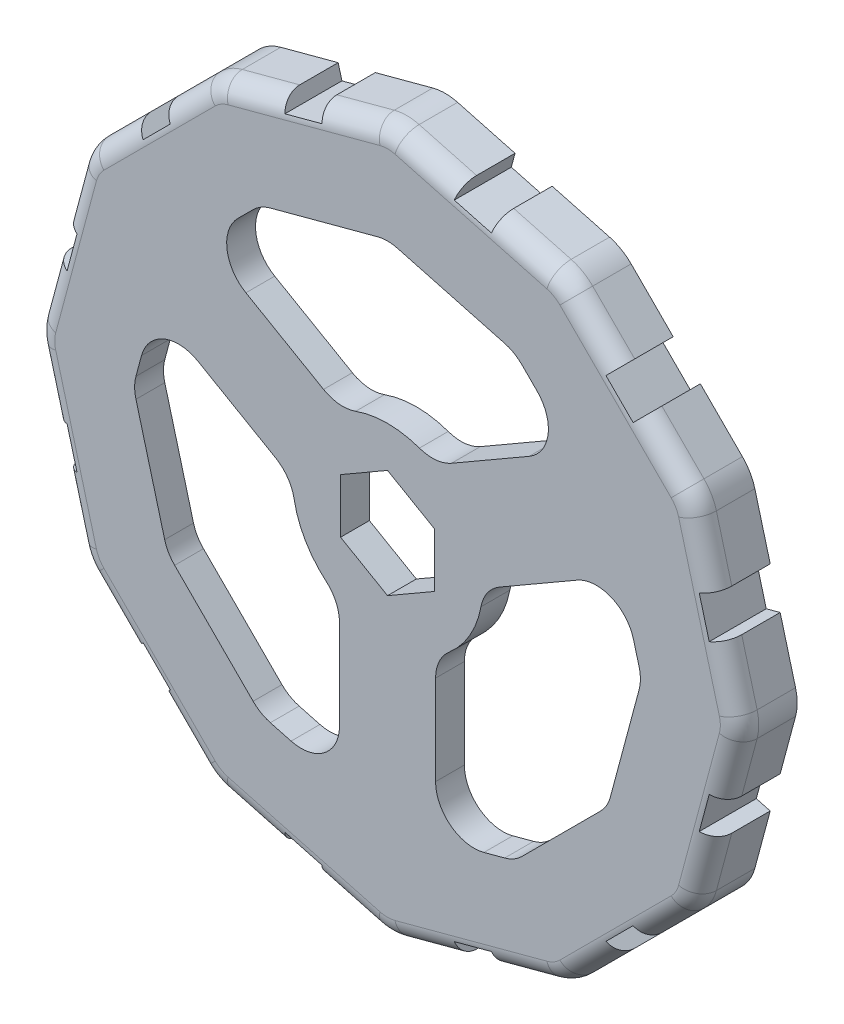
from build123d import *

# Parameters (mm, degrees)
BOSS_EXTRUDE1_DEPTH = 3
BOSS_EXTRUDE2_DEPTH = 3
CUT_EXTRUDE1_DEPTH  = 53.408045027
FILLET1_R           = 5
CUT_EXTRUDE2_DEPTH  = 3
FILLET3_R           = 4
FILLET4_R           = 2
CIRPATTERN1_COUNT   = 12
FILLET5_R           = 3


with BuildPart() as part:
    # Sketch1 → Boss-Extrude1 (new body)
    # profile 1 of 2: a face of its own
    with BuildSketch(Plane.XY):
        Polygon((31.88222379, 18.407210488), (18.407210488, 31.88222379), (0, 36.814420975), (-18.407210488, 31.88222379), (-31.88222379, 18.407210488), (-36.814420975, 0), (-31.88222379, -18.407210488), (-18.407210488, -31.88222379), (0, -36.814420975), (18.407210488, -31.88222379), (31.88222379, -18.407210488), (36.814420975, 0), align=None)
        Polygon((-15.819020037, -27.399346429), (0, -31.638040073), (15.819020037, -27.399346429), (27.399346429, -15.819020037), (31.638040073, 0), (27.399346429, 15.819020037), (15.819020037, 27.399346429), (0, 31.638040073), (-15.819020037, 27.399346429), (-27.399346429, 15.819020037), (-31.638040073, 0), (-27.399346429, -15.819020037), align=None, mode=Mode.SUBTRACT)
    # profile 2 of 2: a face of its own
    with BuildSketch(Plane.XY):
        Polygon((-27.399346429, -15.819020037), (-15.819020037, -27.399346429), (0, -31.638040073), (15.819020037, -27.399346429), (27.399346429, -15.819020037), (31.638040073, 0), (27.399346429, 15.819020037), (15.819020037, 27.399346429), (0, 31.638040073), (-15.819020037, 27.399346429), (-27.399346429, 15.819020037), (-31.638040073, 0), align=None)
        Polygon((4.8875, 2.821799441), (0, 5.643598881), (-4.8875, 2.821799441), (-4.8875, -2.821799441), (0, -5.643598881), (4.8875, -2.821799441), align=None, mode=Mode.SUBTRACT)
    extrude(amount=BOSS_EXTRUDE1_DEPTH)

    # Sketch1<3> → Boss-Extrude2 (add)
    with BuildSketch(Plane.XY):
        Polygon((31.88222379, 18.407210488), (18.407210488, 31.88222379), (0, 36.814420975), (-18.407210488, 31.88222379), (-31.88222379, 18.407210488), (-36.814420975, 0), (-31.88222379, -18.407210488), (-18.407210488, -31.88222379), (0, -36.814420975), (18.407210488, -31.88222379), (31.88222379, -18.407210488), (36.814420975, 0), align=None)
        Polygon((-15.819020037, -27.399346429), (0, -31.638040073), (15.819020037, -27.399346429), (27.399346429, -15.819020037), (31.638040073, 0), (27.399346429, 15.819020037), (15.819020037, 27.399346429), (0, 31.638040073), (-15.819020037, 27.399346429), (-27.399346429, 15.819020037), (-31.638040073, 0), (-27.399346429, -15.819020037), align=None, mode=Mode.SUBTRACT)
    extrude(amount=-BOSS_EXTRUDE2_DEPTH)

    # Sketch2 → Cut-Extrude1 (cut, through all)
    with BuildSketch(Plane.XY.offset(3)):
        Polygon((7.271753591, 34.865960473), (11.135456896, 33.830684293), (10.747228329, 32.381795553), (6.883525024, 33.417071734), align=None)
    cut_extrude1 = extrude(amount=-CUT_EXTRUDE1_DEPTH, mode=Mode.SUBTRACT)

    # Fillet1
    fillet1_edges = [part.edges().sort_by_distance(p)[0] for p in [
        (31.88222379, 18.407210488, 0),
        (36.814420975, 0, 0),
        (31.88222379, -18.407210488, 0),
        (18.407210488, -31.88222379, 0),
        (0, -36.814420975, 0),
        (-18.407210488, -31.88222379, 0),
        (-31.88222379, -18.407210488, 0),
        (-36.814420975, 0, 0),
        (-31.88222379, 18.407210488, 0),
        (-18.407210488, 31.88222379, 0),
        (0, 36.814420975, 0),
        (18.407210488, 31.88222379, 0),
    ]]
    fillet(fillet1_edges, radius=FILLET1_R)

    # Sketch4 → Cut-Extrude2 (cut)
    with BuildSketch(Plane(origin=(0, 0, 0), x_dir=(-1, 0, 0), z_dir=(0, 0, -1))):
        with BuildLine():
            Line((13.230829586, 22.916469069), (0, 26.461659171))
            Line((0, 26.461659171), (-13.230829586, 22.916469069))
            Line((-13.230829586, 22.916469069), (-19.256215031, 16.891083623))
            Line((-19.256215031, 16.891083623), (-4.8875, 8.595302133))
            ThreePointArc((-4.8875, 8.595302133), (0, 9.887713335), (4.8875, 8.595302133))
            Line((4.8875, 8.595302133), (19.256215031, 16.891083623))
            Line((19.256215031, 16.891083623), (13.230829586, 22.916469069))
        make_face()
        with BuildLine():
            Line((5, -8.530350227), (5, -25.121913209))
            Line((5, -25.121913209), (13.230829586, -22.916469069))
            Line((13.230829586, -22.916469069), (22.916469069, -13.230829586))
            Line((22.916469069, -13.230829586), (26.461659171, 0))
            Line((26.461659171, 0), (24.256215031, 8.230829586))
            Line((24.256215031, 8.230829586), (9.8875, -0.064951905))
            ThreePointArc((9.8875, -0.064951905), (8.563010934, -4.943856668), (5, -8.530350227))
        make_face()
        with BuildLine():
            Line((-9.8875, -0.064951905), (-24.256215031, 8.230829586))
            Line((-24.256215031, 8.230829586), (-26.461659171, 0))
            Line((-26.461659171, 0), (-22.916469069, -13.230829586))
            Line((-22.916469069, -13.230829586), (-13.230829586, -22.916469069))
            Line((-13.230829586, -22.916469069), (-5, -25.121913209))
            Line((-5, -25.121913209), (-5, -8.530350227))
            ThreePointArc((-5, -8.530350227), (-8.563010934, -4.943856668), (-9.8875, -0.064951905))
        make_face()
    extrude(amount=-CUT_EXTRUDE2_DEPTH, mode=Mode.SUBTRACT)

    # Fillet3
    fillet3_edges = [part.edges().sort_by_distance(p)[0] for p in [
        (-5, -8.530350227, 1.5),
        (-9.8875, -0.064951905, 1.5),
        (-24.256215031, 8.230829586, 1.5),
        (-26.461659171, 0, 1.5),
        (-22.916469069, -13.230829586, 1.5),
        (-13.230829586, -22.916469069, 1.5),
        (-5, -25.121913209, 1.5),
        (-4.8875, 8.595302133, 1.5),
        (4.8875, 8.595302133, 1.5),
        (19.256215031, 16.891083623, 1.5),
        (13.230829586, 22.916469069, 1.5),
        (0, 26.461659171, 1.5),
        (-13.230829586, 22.916469069, 1.5),
        (-19.256215031, 16.891083623, 1.5),
        (9.8875, -0.064951905, 1.5),
        (5, -8.530350227, 1.5),
        (5, -25.121913209, 1.5),
        (13.230829586, -22.916469069, 1.5),
        (22.916469069, -13.230829586, 1.5),
        (26.461659171, 0, 1.5),
        (24.256215031, 8.230829586, 1.5),
    ]]
    fillet(fillet3_edges, radius=FILLET3_R)

    # Fillet4
    # the kernel refuses this fillet: 2 mm, written as the material it takes off along each edge
    with BuildSketch(Plane(origin=(1.294095226, -36.467669205, 3), x_dir=(-0.25881904510251225, 0.9659258262890706, 0), z_dir=(0.9659258262890706, 0.25881904510251225, 0)), Plane(origin=(-17.113115262, -32.228975561, 3), x_dir=(0.2588190451025292, 0.9659258262890661, 0), z_dir=(0.9659258262890661, -0.2588190451025292, 0)), Plane(origin=(-1.294095226, 36.467669205, 3), x_dir=(0.25881904510251297, -0.9659258262890704, 0), z_dir=(-0.9659258262890704, -0.25881904510251297, 0)), Plane(origin=(-19.354553943, 30.934880335, 3), x_dir=(0.7071067811865416, -0.7071067811865536, 0), z_dir=(-0.7071067811865536, -0.7071067811865415, 0)), Plane(origin=(-32.228975561, 17.113115262, 3), x_dir=(0.9659258262890664, -0.25881904510252784, 0), z_dir=(-0.2588190451025279, -0.9659258262890664, 0)), Plane(origin=(-36.467669205, -1.294095226, 3), x_dir=(0.9659258262890706, 0.2588190451025123, 0), z_dir=(0.2588190451025123, -0.9659258262890705, 0)), Plane(origin=(-30.934880335, -19.354553943, 3), x_dir=(0.7071067811865536, 0.7071067811865416, 0), z_dir=(0.7071067811865416, -0.7071067811865536, 0)), Plane(origin=(30.934880335, 19.354553943, 3), x_dir=(-0.7071067811865546, -0.7071067811865406, 0), z_dir=(-0.7071067811865406, 0.7071067811865546, 0)), Plane(origin=(36.467669205, 1.294095226, 3), x_dir=(-0.9659258262890709, -0.2588190451025115, 0), z_dir=(-0.2588190451025115, 0.9659258262890708, 0)), Plane(origin=(32.228975561, -17.113115262, 3), x_dir=(-0.9659258262890659, 0.25881904510253007, 0), z_dir=(0.25881904510253007, 0.9659258262890659, 0)), Plane(origin=(19.354553943, -30.934880335, 3), x_dir=(-0.707106781186541, 0.7071067811865541, 0), z_dir=(0.7071067811865541, 0.7071067811865409, 0))) as fillet4_piece_1:
        with BuildLine():
            CenterArc((FILLET4_R, -FILLET4_R), FILLET4_R, 90, 90)
            Line((0, -FILLET4_R), (0, 0))
            Line((0, 0), (FILLET4_R, 0))
        make_face()
    extrude(amount=16.377054641, mode=Mode.SUBTRACT)
    with BuildSketch(Plane(origin=(0, -31.638040073, 3), x_dir=(0.258819045102512, -0.9659258262890706, 0), z_dir=(0.9659258262890706, 0.258819045102512, 0))) as fillet4_piece_2:
        with BuildLine():
            CenterArc((5 - FILLET4_R, FILLET4_R), FILLET4_R, 270, 90)
            Line((5, FILLET4_R), (5, 0))
            Line((5, 0), (5 - FILLET4_R, 0))
        make_face()
    revolve(axis=Axis((0, -31.638040073, 3), (0, 0, -1)), revolution_arc=30, mode=Mode.SUBTRACT)
    with BuildSketch(Plane(origin=(0, 31.638040073, 3), x_dir=(-0.2588190451025133, 0.9659258262890702, 0), z_dir=(-0.9659258262890702, -0.2588190451025133, 0))) as fillet4_piece_3:
        with BuildLine():
            CenterArc((5 - FILLET4_R, FILLET4_R), FILLET4_R, 270, 90)
            Line((5, FILLET4_R), (5, 0))
            Line((5, 0), (5 - FILLET4_R, 0))
        make_face()
    revolve(axis=Axis((0, 31.638040073, 3), (0, 0, -1)), revolution_arc=30, mode=Mode.SUBTRACT)
    with BuildSketch(Plane(origin=(-15.819020037, 27.399346429, 3), x_dir=(-0.7071067811865419, 0.7071067811865532, 0), z_dir=(-0.7071067811865532, -0.7071067811865419, 0))) as fillet4_piece_4:
        with BuildLine():
            CenterArc((5 - FILLET4_R, FILLET4_R), FILLET4_R, 270, 90)
            Line((5, FILLET4_R), (5, 0))
            Line((5, 0), (5 - FILLET4_R, 0))
        make_face()
    revolve(axis=Axis((-15.819020037, 27.399346429, 3), (0, 0, -1)), revolution_arc=30, mode=Mode.SUBTRACT)
    with BuildSketch(Plane(origin=(-27.399346429, 15.819020037, 3), x_dir=(-0.9659258262890666, 0.25881904510252696, 0), z_dir=(-0.25881904510252696, -0.9659258262890666, 0))) as fillet4_piece_5:
        with BuildLine():
            CenterArc((5 - FILLET4_R, FILLET4_R), FILLET4_R, 270, 90)
            Line((5, FILLET4_R), (5, 0))
            Line((5, 0), (5 - FILLET4_R, 0))
        make_face()
    revolve(axis=Axis((-27.399346429, 15.819020037, 3), (0, 0, -1)), revolution_arc=30, mode=Mode.SUBTRACT)
    with BuildSketch(Plane(origin=(-31.638040073, 0, 3), x_dir=(-0.9659258262890706, -0.25881904510251186, 0), z_dir=(0.25881904510251186, -0.9659258262890706, 0))) as fillet4_piece_6:
        with BuildLine():
            CenterArc((5 - FILLET4_R, FILLET4_R), FILLET4_R, 270, 90)
            Line((5, FILLET4_R), (5, 0))
            Line((5, 0), (5 - FILLET4_R, 0))
        make_face()
    revolve(axis=Axis((-31.638040073, 0, 3), (0, 0, -1)), revolution_arc=30, mode=Mode.SUBTRACT)
    with BuildSketch(Plane(origin=(-27.399346429, -15.819020037, 3), x_dir=(-0.7071067811865532, -0.7071067811865419, 0), z_dir=(0.7071067811865419, -0.7071067811865532, 0))) as fillet4_piece_7:
        with BuildLine():
            CenterArc((5 - FILLET4_R, FILLET4_R), FILLET4_R, 270, 90)
            Line((5, FILLET4_R), (5, 0))
            Line((5, 0), (5 - FILLET4_R, 0))
        make_face()
    revolve(axis=Axis((-27.399346429, -15.819020037, 3), (0, 0, -1)), revolution_arc=30, mode=Mode.SUBTRACT)
    with BuildSketch(Plane(origin=(-15.819020037, -27.399346429, 3), x_dir=(-0.2588190451025303, -0.9659258262890658, 0), z_dir=(0.9659258262890658, -0.2588190451025303, 0))) as fillet4_piece_8:
        with BuildLine():
            CenterArc((5 - FILLET4_R, FILLET4_R), FILLET4_R, 270, 90)
            Line((5, FILLET4_R), (5, 0))
            Line((5, 0), (5 - FILLET4_R, 0))
        make_face()
    revolve(axis=Axis((-15.819020037, -27.399346429, 3), (0, 0, -1)), revolution_arc=30, mode=Mode.SUBTRACT)
    with BuildSketch(Plane(origin=(17.113115262, 32.228975561, 3), x_dir=(-0.25881904510253, -0.9659258262890659, 0), z_dir=(-0.9659258262890659, 0.25881904510253, 0)), Plane(origin=(12.101382723, 33.571865248, 3), x_dir=(-0.25881904510253, -0.9659258262890659, 0), z_dir=(-0.9659258262890659, 0.25881904510253, 0))) as fillet4_piece_9:
        with BuildLine():
            CenterArc((FILLET4_R, -FILLET4_R), FILLET4_R, 90, 90)
            Line((0, -FILLET4_R), (0, 0))
            Line((0, 0), (FILLET4_R, 0))
        make_face()
    extrude(amount=11.188527321, mode=Mode.SUBTRACT)
    with BuildSketch(Plane(origin=(15.819020037, 27.399346429, 3), x_dir=(0.7071067811865547, 0.7071067811865405, 0), z_dir=(0.7071067811865405, -0.7071067811865547, 0))) as fillet4_piece_10:
        with BuildLine():
            CenterArc((5 - FILLET4_R, -FILLET4_R), FILLET4_R, 0, 90)
            Line((5, -FILLET4_R), (5, 0))
            Line((5, 0), (5 - FILLET4_R, 0))
        make_face()
    revolve(axis=Axis((15.819020037, 27.399346429, 3), (0, 0, 1)), revolution_arc=30, mode=Mode.SUBTRACT)
    with BuildSketch(Plane(origin=(27.399346429, 15.819020037, 3), x_dir=(0.7071067811865547, 0.7071067811865405, 0), z_dir=(-0.7071067811865405, 0.7071067811865547, 0))) as fillet4_piece_11:
        with BuildLine():
            CenterArc((5 - FILLET4_R, FILLET4_R), FILLET4_R, 270, 90)
            Line((5, FILLET4_R), (5, 0))
            Line((5, 0), (5 - FILLET4_R, 0))
        make_face()
    revolve(axis=Axis((27.399346429, 15.819020037, 3), (0, 0, -1)), revolution_arc=30, mode=Mode.SUBTRACT)
    with BuildSketch(Plane(origin=(31.638040073, 0, 3), x_dir=(0.9659258262890706, 0.2588190451025117, 0), z_dir=(-0.2588190451025117, 0.9659258262890706, 0))) as fillet4_piece_12:
        with BuildLine():
            CenterArc((5 - FILLET4_R, FILLET4_R), FILLET4_R, 270, 90)
            Line((5, FILLET4_R), (5, 0))
            Line((5, 0), (5 - FILLET4_R, 0))
        make_face()
    revolve(axis=Axis((31.638040073, 0, 3), (0, 0, -1)), revolution_arc=30, mode=Mode.SUBTRACT)
    with BuildSketch(Plane(origin=(27.399346429, -15.819020037, 3), x_dir=(0.9659258262890658, -0.2588190451025301, 0), z_dir=(0.2588190451025301, 0.9659258262890658, 0))) as fillet4_piece_13:
        with BuildLine():
            CenterArc((5 - FILLET4_R, FILLET4_R), FILLET4_R, 270, 90)
            Line((5, FILLET4_R), (5, 0))
            Line((5, 0), (5 - FILLET4_R, 0))
        make_face()
    revolve(axis=Axis((27.399346429, -15.819020037, 3), (0, 0, -1)), revolution_arc=30, mode=Mode.SUBTRACT)
    with BuildSketch(Plane(origin=(15.819020037, -27.399346429, 3), x_dir=(0.7071067811865411, -0.7071067811865539, 0), z_dir=(0.7071067811865539, 0.7071067811865411, 0))) as fillet4_piece_14:
        with BuildLine():
            CenterArc((5 - FILLET4_R, FILLET4_R), FILLET4_R, 270, 90)
            Line((5, FILLET4_R), (5, 0))
            Line((5, 0), (5 - FILLET4_R, 0))
        make_face()
    revolve(axis=Axis((15.819020037, -27.399346429, 3), (0, 0, -1)), revolution_arc=30, mode=Mode.SUBTRACT)

    # CirPattern1: Cut-Extrude1 ×12 about axis
    cirpattern1_axis = Axis((0, 0, 0), (0, 0, 1))
    for i in range(1, CIRPATTERN1_COUNT):
        add(cut_extrude1.rotate(cirpattern1_axis, i * 360 / CIRPATTERN1_COUNT), mode=Mode.SUBTRACT)

    # Fillet5
    fillet5_edges = [part.edges().sort_by_distance(p)[0] for p in [
        (-15.819020037, -27.399346429, -1.5),
        (0, -31.638040073, -1.5),
        (15.819020037, -27.399346429, -1.5),
        (27.399346429, -15.819020037, -1.5),
        (31.638040073, 0, -1.5),
        (27.399346429, 15.819020037, -1.5),
        (15.819020037, 27.399346429, -1.5),
        (0, 31.638040073, -1.5),
        (-15.819020037, 27.399346429, -1.5),
        (-27.399346429, 15.819020037, -1.5),
        (-31.638040073, 0, -1.5),
        (-27.399346429, -15.819020037, -1.5),
    ]]
    fillet(fillet5_edges, radius=FILLET5_R)


solid = part.part
